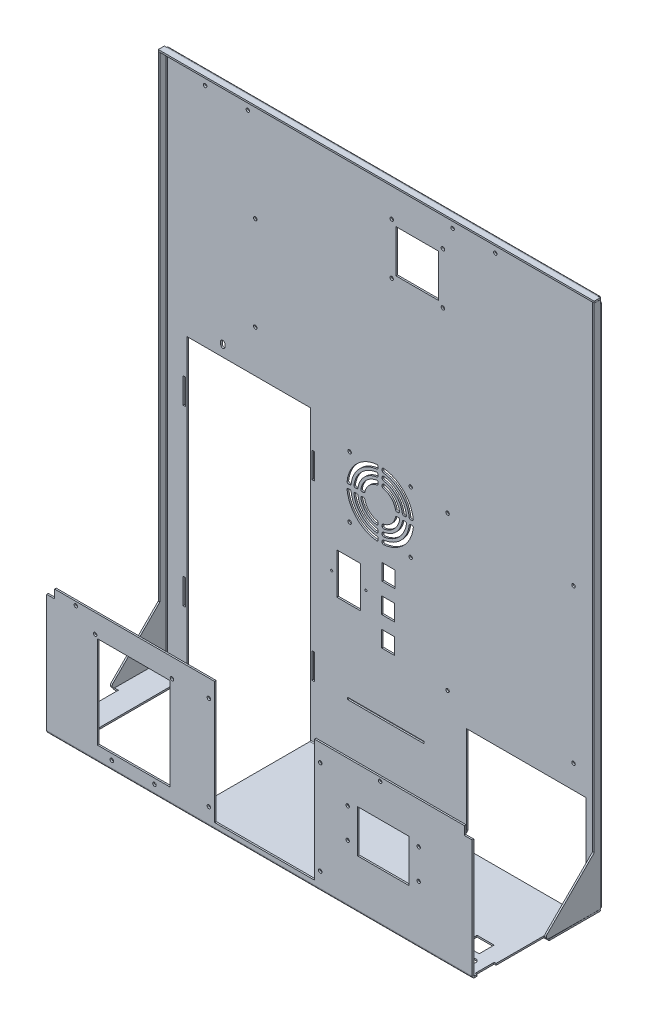
from build123d import *

# Parameters (mm, degrees)
SKETCH1_W                    = 500
SKETCH1_H                    = 616
BASE_FLANGE1_DEPTH           = 1.9
EDGE_FLANGE1_STRIP_W         = 9.6
EDGE_FLANGE1_STRIP_H         = 1.9
EDGE_FLANGE1_STRIP_CUT_DEPTH = 500
EDGE_FLANGE1_DEPTH           = 500
EDGE_FLANGE3_STRIP_W         = 9.6
EDGE_FLANGE3_STRIP_H         = 1.9
EDGE_FLANGE3_STRIP_CUT_DEPTH = 500
EDGE_FLANGE3_DEPTH           = 500
SKETCH18_W                   = 60
SKETCH18_H                   = 50
SKETCH18_W_2                 = 117
SKETCH18_H_2                 = 153.16
SKETCH18_W_3                 = 85
SKETCH18_H_3                 = 108
SKETCH18_R                   = 2.04
CUT_EXTRUDE1_DEPTH           = 2
CUT_EXTRUDE6_DEPTH           = 10
SKETCH54_W                   = 145
SKETCH54_H                   = 174.941221568
CUT_EXTRUDE8_DEPTH           = 340
SKETCH55_R                   = 3.999999998
CUT_EXTRUDE10_DEPTH          = 10
SKETCH56_W                   = 20
SKETCH56_H                   = 17.5
CUT_EXTRUDE11_DEPTH          = 10
SKETCH66_R                   = 2.04
CUT_EXTRUDE15_DEPTH          = 3.21412
SKETCH67_R                   = 2.04
CUT_EXTRUDE16_DEPTH          = 3.21412
EDGE_FLANGE5_DEPTH           = 613.1
EDGE_FLANGE5_BEND_DEPTH      = 613.1
SKETCH76_R                   = 2.04
CUT_EXTRUDE19_DEPTH          = 10
SKETCH78_R                   = 2.04
SKETCH78_W                   = 50
SKETCH78_H                   = 50
CUT_EXTRUDE21_DEPTH          = 10
EDGE_FLANGE6_DEPTH           = 505
CLOSED_START                 = 145.877724614
CLOSED_CORNER1_OUTLINE_W     = 4.55
CLOSED_CORNER1_OUTLINE_H     = 67.1
CLOSED_CORNER1_OUTLINE_W_2   = 1.9
CLOSED_CORNER1_OUTLINE_H_2   = 7.1
CLOSED_CORNER1_DEPTH         = 1.9
CLOSED_START_2               = 144.877724614
CLOSED_CORNER1_2_OUTLINE_W   = 1.9
CLOSED_CORNER1_2_OUTLINE_H   = 7.1
CLOSED_CORNER1_2_DEPTH       = 1
CLOSED_START_3               = -363.022275386
CLOSED_CORNER2_OUTLINE_W     = 4.55
CLOSED_CORNER2_OUTLINE_H     = 67.1
CLOSED_CORNER2_OUTLINE_W_2   = 1.9
CLOSED_CORNER2_OUTLINE_H_2   = 7.1
CLOSED_CORNER2_DEPTH         = 1.9
CLOSED_START_4               = -361.122275386
CLOSED_CORNER2_2_OUTLINE_W   = 1.9
CLOSED_CORNER2_2_OUTLINE_H   = 7.1
CLOSED_CORNER2_2_DEPTH       = 1
SKETCH83_R                   = 2.04
CUT_EXTRUDE23_DEPTH          = 10
SKETCH84_W                   = 3
SKETCH84_H                   = 22.219323402
CUT_EXTRUDE24_DEPTH          = 2
SKETCH86_W                   = 89.593151393
SKETCH86_H                   = 2.431814109
CUT_EXTRUDE25_DEPTH          = 10
SKETCH87_R                   = 2.5
CUT_EXTRUDE26_DEPTH          = 10
SKETCH88_R                   = 2.5
CUT_EXTRUDE29_DEPTH          = 10
SKETCH89_W                   = 10
SKETCH89_H                   = 10
CUT_EXTRUDE28_DEPTH          = 5
SKETCH91_W                   = 0.75
SKETCH91_H                   = 155.908548617
SKETCH91_H_2                 = 115.430886914
CUT_EXTRUDE30_DEPTH          = 150
SKETCH99_R                   = 2.04
CUT_EXTRUDE32_DEPTH          = 10
SKETCH100_W                  = 137.515853673
SKETCH100_H                  = 131.918778432
CUT_EXTRUDE33_DEPTH          = 10
CUT_EXTRUDE34_DEPTH          = 740.00822209
SKETCH102_W                  = 140
SKETCH102_H                  = 110.554078745
CUT_EXTRUDE35_DEPTH          = 20
SKETCH103_W                  = 28
SKETCH103_H                  = 48
CUT_EXTRUDE36_DEPTH          = 62
SKETCH104_W                  = 15
SKETCH104_H                  = 19
CUT_EXTRUDE37_DEPTH          = 62
CLOSED_CORNER3_OUTLINE_W     = 1.9
CLOSED_CORNER3_OUTLINE_H     = 60
CLOSED_CORNER3_DEPTH         = 5.4
CLOSED_CORNER3_2_DEPTH       = 1.9
CLOSED_START_5               = 142.377724614
CLOSED_CORNER4_OUTLINE_W     = 1.9
CLOSED_CORNER4_OUTLINE_H     = 60
CLOSED_CORNER4_DEPTH         = 5.4
CLOSED_CORNER4_2_DEPTH       = 1.9
CUT_EXTRUDE41_DEPTH          = 740.00822209
SKETCH161_W                  = 2.9
SKETCH161_H                  = 30
CUT_EXTRUDE42_DEPTH          = 10
SKETCH162_R                  = 2.5
CUT_EXTRUDE43_DEPTH          = 10
CUT_EXTRUDE44_DEPTH          = 10
SKETCH164_R                  = 1.25
CUT_EXTRUDE45_DEPTH          = 10


# Read off the part's stored shape, not the designer's step: Closed Corner1, Closed Corner2, Closed Corner3, Closed Corner4
# Sheet-metal steps are written as plain solids
with BuildPart() as part:
    # Sketch1 → Base-Flange1 (new body)
    with BuildSketch(Plane.XY):
        with Locations((-107.622275386, 199.456916993)):
            Rectangle(SKETCH1_W, SKETCH1_H)
    extrude(amount=-BASE_FLANGE1_DEPTH)

    # Edge-Flange1 strip (across the edge) → Edge-Flange1 strip cut (cut)
    with BuildSketch(Plane(origin=(-357.622275386, -108.543083007, 0), x_dir=(0, 1, 0), z_dir=(1, 0, 0))):
        with Locations((-1.9, -0.95)):
            Rectangle(EDGE_FLANGE1_STRIP_W, EDGE_FLANGE1_STRIP_H)
    extrude(amount=EDGE_FLANGE1_STRIP_CUT_DEPTH, mode=Mode.SUBTRACT)

    # Edge-Flange1 section (across the edge) → Edge-Flange1 (add)
    with BuildSketch(Plane(origin=(-357.622275386, -108.543083007, 0), x_dir=(0, 1, 0), z_dir=(1, 0, 0))):
        with BuildLine():
            Line((0, 1), (0, 144.96))
            Line((0, 144.96), (1.9, 144.96))
            Line((1.9, 144.96), (1.9, 1))
            ThreePointArc((1.9, 1), (2.192893219, 0.292893219), (2.9, 0))
            Line((2.9, 0), (2.9, -1.9))
            ThreePointArc((2.9, -1.9), (0.849390335, -1.050609665), (0, 1))
        make_face()
    extrude(amount=EDGE_FLANGE1_DEPTH)

    # Edge-Flange3 strip (across the edge) → Edge-Flange3 strip cut (cut)
    with BuildSketch(Plane(origin=(-357.622275386, -106.643083007, 144.96), x_dir=(0, 0, -1), z_dir=(1, 0, 0))):
        with Locations((-1.9, -0.95)):
            Rectangle(EDGE_FLANGE3_STRIP_W, EDGE_FLANGE3_STRIP_H)
    extrude(amount=EDGE_FLANGE3_STRIP_CUT_DEPTH, mode=Mode.SUBTRACT)

    # Edge-Flange3 section (across the edge) → Edge-Flange3 (add)
    with BuildSketch(Plane(origin=(-357.622275386, -106.643083007, 144.96), x_dir=(0, 0, -1), z_dir=(1, 0, 0))):
        with BuildLine():
            Line((0, 1), (0, 149.26))
            Line((0, 149.26), (1.9, 149.26))
            Line((1.9, 149.26), (1.9, 1))
            ThreePointArc((1.9, 1), (2.192893219, 0.292893219), (2.9, 0))
            Line((2.9, 0), (2.9, -1.9))
            ThreePointArc((2.9, -1.9), (0.849390335, -1.050609665), (0, 1))
        make_face()
    extrude(amount=EDGE_FLANGE3_DEPTH)

    # Sketch18 → Cut-Extrude1 (cut)
    with BuildSketch(Plane.XY.offset(144.96)):
        with Locations((37.377724614, -25.643083007)):
            Rectangle(SKETCH18_W, SKETCH18_H)
        with Locations((-101.67397197, -23.963083007)):
            Rectangle(SKETCH18_W_2, SKETCH18_H_2)
        with Locations((-255.122275386, -36.643083007)):
            Rectangle(SKETCH18_W_3, SKETCH18_H_3)
        with Locations((-300.122275386, 20.356916993)):
            Circle(SKETCH18_R)
        with Locations((-210.122275386, 20.356916993)):
            Circle(SKETCH18_R)
        with Locations((-280.622275386, -97.643083007)):
            Circle(SKETCH18_R)
        with Locations((-230.625639047, -97.063122025)):
            Circle(SKETCH18_R)
        with Locations((-166.93397197, 22.056916993)):
            Circle(SKETCH18_R)
        with Locations((-166.93397197, -87.943083007)):
            Circle(SKETCH18_R)
        with Locations((-36.41397197, 22.056916993)):
            Circle(SKETCH18_R)
        with Locations((-36.41397197, -87.943083007)):
            Circle(SKETCH18_R)
        with Locations((-4.224895386, -5.643083007)):
            Circle(SKETCH18_R)
        with Locations((-4.224895386, -40.643083007)):
            Circle(SKETCH18_R)
        with Locations((78.980344614, -5.643083007)):
            Circle(SKETCH18_R)
        with Locations((78.980344614, -40.643083007)):
            Circle(SKETCH18_R)
    extrude(amount=-CUT_EXTRUDE1_DEPTH, mode=Mode.SUBTRACT)

    # Sketch51 → Cut-Extrude6 (cut)
    with BuildSketch(Plane(origin=(0, 0, -1.9), x_dir=(-1, 0, 0), z_dir=(0, 0, -1))):
        with BuildLine():
            Line((77.622275386, 455.956916993), (64.103016085, 455.956916993))
            ThreePointArc((64.103016085, 455.956916993), (49.122275386, 450.456916993), (64.103016085, 444.956916993))
            Line((64.103016085, 444.956916993), (77.622275386, 444.956916993))
            ThreePointArc((77.622275386, 444.956916993), (83.122275386, 450.456916993), (77.622275386, 455.956916993))
        make_face()
    extrude(amount=-CUT_EXTRUDE6_DEPTH, mode=Mode.SUBTRACT)

    # Sketch54 → Cut-Extrude8 (cut)
    with BuildSketch(Plane(origin=(0, -108.543083007, 0), x_dir=(-1, 0, 0), z_dir=(0, -1, 0))):
        with Locations((265.122275386, 84.429389216)):
            Rectangle(SKETCH54_W, SKETCH54_H)
    extrude(amount=-CUT_EXTRUDE8_DEPTH, mode=Mode.SUBTRACT)

    # Sketch55 → Cut-Extrude10 (cut)
    with BuildSketch(Plane.XZ.offset(108.543083007)):
        with Locations(Location((125.035496452, 128.18, 0), (0, 0, 270))):
            Circle(SKETCH55_R)
        with Locations(Location((-340.280047224, 128.18, 0), (0, 0, 270))):
            Circle(SKETCH55_R)
    extrude(amount=-CUT_EXTRUDE10_DEPTH, mode=Mode.SUBTRACT)

    # Sketch56 → Cut-Extrude11 (cut)
    with BuildSketch(Plane(origin=(0, -108.543083007, 0), x_dir=(-1, 0, 0), z_dir=(0, -1, 0))):
        with Locations((-111.917595603, -108.273341907)):
            Rectangle(SKETCH56_W, SKETCH56_H)
    extrude(amount=-CUT_EXTRUDE11_DEPTH, mode=Mode.SUBTRACT)

    # Sketch66 → Cut-Extrude15 (cut)
    with BuildSketch(Plane.XY):
        with Locations((-32.193957988, 204.920176993)):
            Circle(SKETCH66_R)
        with Locations((115.411282012, 204.920176993)):
            Circle(SKETCH66_R)
        with Locations((-32.193957988, 24.920176993)):
            Circle(SKETCH66_R)
        with Locations((115.411282012, 24.920176993)):
            Circle(SKETCH66_R)
    extrude(amount=-CUT_EXTRUDE15_DEPTH, mode=Mode.SUBTRACT)

    # Sketch67 → Cut-Extrude16 (cut)
    with BuildSketch(Plane.XY.offset(144.96)):
        with Locations((-322.795569154, 38.116916993)):
            Circle(SKETCH67_R)
        with Locations((33.746280713, 38.116916993)):
            Circle(SKETCH67_R)
    extrude(amount=-CUT_EXTRUDE16_DEPTH, mode=Mode.SUBTRACT)

    # Edge-Flange5 section (across the edge) → Edge-Flange5 (add)
    with BuildSketch(Plane(origin=(145.877724614, -105.643083007, 0), x_dir=(-1, 0, 0), z_dir=(0, 1, 0))):
        with BuildLine():
            Line((-1.9, 1), (-1.9, 68.1))
            Line((-1.9, 68.1), (0, 68.1))
            Line((0, 68.1), (0, 1))
            ThreePointArc((0, 1), (0.292893219, 0.292893219), (1, 0))
            Line((1, 0), (3.5, 0))
            Line((3.5, 0), (3.5, -1.9))
            Line((3.5, -1.9), (1, -1.9))
            ThreePointArc((1, -1.9), (-1.050609665, -1.050609665), (-1.9, 1))
        make_face()
    extrude(amount=EDGE_FLANGE5_DEPTH)

    # Edge-Flange5 section 2 (across the edge) → Edge-Flange5 bend (add)
    with BuildSketch(Plane(origin=(-361.122275386, 507.456916993, 0), x_dir=(1, 0, 0), z_dir=(0, -1, 0))):
        with BuildLine():
            Line((-1.9, 1), (-1.9, 68.1))
            Line((-1.9, 68.1), (0, 68.1))
            Line((0, 68.1), (0, 1))
            ThreePointArc((0, 1), (0.292893219, 0.292893219), (1, 0))
            Line((1, 0), (3.5, 0))
            Line((3.5, 0), (3.5, -1.9))
            Line((3.5, -1.9), (1, -1.9))
            ThreePointArc((1, -1.9), (-1.050609665, -1.050609665), (-1.9, 1))
        make_face()
    extrude(amount=EDGE_FLANGE5_BEND_DEPTH)

    # Sketch76 → Cut-Extrude19 (cut)
    with BuildSketch(Plane.XY):
        with Locations((-257.493957988, 391.022796993)):
            Circle(SKETCH76_R)
        with Locations((-257.493957988, 281.022796993)):
            Circle(SKETCH76_R)
    extrude(amount=-CUT_EXTRUDE19_DEPTH, mode=Mode.SUBTRACT)

    # Sketch78 → Cut-Extrude21 (cut)
    with BuildSketch(Plane.XY):
        with Locations((-97.622275386, 470.456916993)):
            Circle(SKETCH78_R)
        with Locations((-37.622275386, 470.456916993)):
            Circle(SKETCH78_R)
        with Locations((-37.622275386, 410.456916993)):
            Circle(SKETCH78_R)
        with Locations((-97.622275386, 410.456916993)):
            Circle(SKETCH78_R)
        with Locations((-67.622275386, 440.456916993)):
            Rectangle(SKETCH78_W, SKETCH78_H)
    extrude(amount=-CUT_EXTRUDE21_DEPTH, mode=Mode.SUBTRACT)

    # Edge-Flange6 section (across the edge) → Edge-Flange6 (add)
    with BuildSketch(Plane(origin=(144.877724614, 512.106916993, 0), x_dir=(0, -1, 0), z_dir=(-1, 0, 0))):
        with BuildLine():
            Line((-1.9, 1), (-1.9, 8.1))
            Line((-1.9, 8.1), (0, 8.1))
            Line((0, 8.1), (0, 1))
            ThreePointArc((0, 1), (0.292893219, 0.292893219), (1, 0))
            Line((1, 0), (4.65, 0))
            Line((4.65, 0), (4.65, -1.9))
            Line((4.65, -1.9), (1, -1.9))
            ThreePointArc((1, -1.9), (-1.050609665, -1.050609665), (-1.9, 1))
        make_face()
    extrude(amount=EDGE_FLANGE6_DEPTH)

    # Closed Corner1 outline → Closed Corner1 (add)
    with BuildSketch(Plane.YZ.offset(CLOSED_START)):
        with Locations((509.731916993, 34.55)):
            Rectangle(CLOSED_CORNER1_OUTLINE_W, CLOSED_CORNER1_OUTLINE_H)
        with Locations((513.056916993, 4.55)):
            Rectangle(CLOSED_CORNER1_OUTLINE_W_2, CLOSED_CORNER1_OUTLINE_H_2)
    extrude(amount=CLOSED_CORNER1_DEPTH)

    # Closed Corner1 2 outline → Closed Corner1 2 (add)
    with BuildSketch(Plane.YZ.offset(CLOSED_START_2)):
        with Locations((513.056916993, 4.55)):
            Rectangle(CLOSED_CORNER1_2_OUTLINE_W, CLOSED_CORNER1_2_OUTLINE_H)
    extrude(amount=CLOSED_CORNER1_2_DEPTH)

    # Closed Corner2 outline → Closed Corner2 (add)
    with BuildSketch(Plane.YZ.offset(CLOSED_START_3)):
        with Locations((509.731916993, 34.55)):
            Rectangle(CLOSED_CORNER2_OUTLINE_W, CLOSED_CORNER2_OUTLINE_H)
        with Locations((513.056916993, 4.55)):
            Rectangle(CLOSED_CORNER2_OUTLINE_W_2, CLOSED_CORNER2_OUTLINE_H_2)
    extrude(amount=CLOSED_CORNER2_DEPTH)

    # Closed Corner2 2 outline → Closed Corner2 2 (add)
    with BuildSketch(Plane.YZ.offset(CLOSED_START_4)):
        with Locations((513.056916993, 4.55)):
            Rectangle(CLOSED_CORNER2_2_OUTLINE_W, CLOSED_CORNER2_2_OUTLINE_H)
    extrude(amount=CLOSED_CORNER2_2_DEPTH)

    # Sketch83 → Cut-Extrude23 (cut)
    with BuildSketch(Plane(origin=(0, 0, -1.9), x_dir=(-1, 0, 0), z_dir=(0, 0, -1))):
        with Locations((-23.767050846, 496.764856993)):
            Circle(SKETCH83_R)
        with Locations((26.232949154, 496.764856993)):
            Circle(SKETCH83_R)
        with Locations((266.232949154, 496.764856993)):
            Circle(SKETCH83_R)
        with Locations((316.232949154, 496.764856993)):
            Circle(SKETCH83_R)
    extrude(amount=-CUT_EXTRUDE23_DEPTH, mode=Mode.SUBTRACT)

    # Sketch84 → Cut-Extrude24 (cut)
    with BuildSketch(Plane.XZ.offset(108.543083007)):
        with Locations((-356.122275386, 128.02122392)):
            Rectangle(SKETCH84_W, SKETCH84_H)
        with Locations((140.877724614, 128.02122392)):
            Rectangle(SKETCH84_W, SKETCH84_H)
    extrude(amount=-CUT_EXTRUDE24_DEPTH, mode=Mode.SUBTRACT)

    # Sketch86 → Cut-Extrude25 (cut)
    with BuildSketch(Plane(origin=(0, 0, -1.9), x_dir=(-1, 0, 0), z_dir=(0, 0, -1))):
        with Locations((104.43682481, -41.63719723)):
            Rectangle(SKETCH86_W, SKETCH86_H)
    extrude(amount=-CUT_EXTRUDE25_DEPTH, mode=Mode.SUBTRACT)

    # Sketch87 → Cut-Extrude26 (cut)
    with BuildSketch(Plane(origin=(0, 0, -1.9), x_dir=(-1, 0, 0), z_dir=(0, 0, -1))):
        with Locations((295.475852873, 242.856916993)):
            Circle(SKETCH87_R)
    extrude(amount=-CUT_EXTRUDE26_DEPTH, mode=Mode.SUBTRACT)

    # Sketch88 → Cut-Extrude29 (cut)
    with BuildSketch(Plane(origin=(0, -106.643083007, 0), x_dir=(1, 0, 0), z_dir=(0, 1, 0))):
        with Locations(Location((-334.692275386, -109.881948443, 0), (0, 0, 270))):
            Circle(SKETCH88_R)
        with Locations(Location((-188.122275386, -129.881948443, 0), (0, 0, 270))):
            Circle(SKETCH88_R)
    extrude(amount=-CUT_EXTRUDE29_DEPTH, mode=Mode.SUBTRACT)

    # Sketch89 → Cut-Extrude28 (cut)
    with BuildSketch(Plane.XY.offset(144.96)):
        with Locations((-352.622275386, 37.616916993)):
            Rectangle(SKETCH89_W, SKETCH89_H)
        with Locations((137.377724614, 37.616916993)):
            Rectangle(SKETCH89_W, SKETCH89_H)
    extrude(amount=-CUT_EXTRUDE28_DEPTH, mode=Mode.SUBTRACT)

    # Sketch91 → Cut-Extrude30 (cut)
    with BuildSketch(Plane.XZ.offset(108.543083007)):
        with Locations((-357.304122799, 138.954274309)):
            Rectangle(SKETCH91_W, SKETCH91_H)
        with Locations((142.002724614, 118.715443457)):
            Rectangle(SKETCH91_W, SKETCH91_H_2)
    extrude(amount=-CUT_EXTRUDE30_DEPTH, mode=Mode.SUBTRACT)

    # Sketch99 → Cut-Extrude32 (cut)
    with BuildSketch(Plane(origin=(0, 0, -1.9), x_dir=(-1, 0, 0), z_dir=(0, 0, -1))):
        with Locations((146.885395546, 209.882570308)):
            Circle(SKETCH99_R)
        with Locations((75.385395546, 209.882570308)):
            Circle(SKETCH99_R)
        with Locations((75.385395546, 138.382570308)):
            Circle(SKETCH99_R)
        with Locations((146.885395546, 138.382570308)):
            Circle(SKETCH99_R)
        with BuildLine():
            Line((113.516645546, 154.581316552), (113.516645546, 152.963892274))
            ThreePointArc((113.516645546, 152.963892274), (114.090300643, 151.742305289), (115.396676742, 151.403577643))
            ThreePointArc((115.396676742, 151.403577643), (127.487239861, 157.780725993), (133.864388211, 169.871289112))
            ThreePointArc((133.864388211, 169.871289112), (133.525660565, 171.177665211), (132.30407358, 171.751320308))
            Line((132.30407358, 171.751320308), (130.686649302, 171.751320308))
            ThreePointArc((130.686649302, 171.751320308), (129.681957963, 171.392946649), (129.13087911, 170.479629362))
            ThreePointArc((129.13087911, 170.479629362), (124.119643816, 161.148322038), (114.788336492, 156.137086744))
            ThreePointArc((114.788336492, 156.137086744), (113.875019206, 155.586007892), (113.516645546, 154.581316552))
        make_face()
        with BuildLine():
            Line((113.516645546, 146.528916932), (113.516645546, 144.925984605))
            ThreePointArc((113.516645546, 144.925984605), (114.059918025, 143.7302651), (115.317899257, 143.352941185))
            ThreePointArc((115.317899257, 143.352941185), (133.099899937, 152.168065917), (141.915024669, 169.950066597))
            ThreePointArc((141.915024669, 169.950066597), (141.537700754, 171.20804783), (140.341981249, 171.751320308))
            Line((140.341981249, 171.751320308), (138.739048922, 171.751320308))
            ThreePointArc((138.739048922, 171.751320308), (137.699456311, 171.36357172), (137.167706932, 170.38974198))
            ThreePointArc((137.167706932, 170.38974198), (129.732303892, 155.535661963), (114.878223874, 148.100258922))
            ThreePointArc((114.878223874, 148.100258922), (113.904394134, 147.568509544), (113.516645546, 146.528916932))
        make_face()
        with BuildLine():
            Line((113.516645546, 138.528081147), (113.516645546, 136.93117007))
            ThreePointArc((113.516645546, 136.93117007), (114.042821863, 135.750598898), (115.272548904, 135.352627527))
            ThreePointArc((115.272548904, 135.352627527), (138.712560013, 146.555405842), (149.915338327, 169.99541695))
            ThreePointArc((149.915338327, 169.99541695), (149.517366956, 171.225143991), (148.336795785, 171.751320308))
            Line((148.336795785, 171.751320308), (146.739884708, 171.751320308))
            ThreePointArc((146.739884708, 171.751320308), (145.681355217, 171.346897468), (145.162156123, 170.339686061))
            ThreePointArc((145.162156123, 170.339686061), (135.344963967, 149.923001887), (114.928279793, 140.105809731))
            ThreePointArc((114.928279793, 140.105809731), (113.921068386, 139.586610637), (113.516645546, 138.528081147))
        make_face()
        with BuildLine():
            Line((91.58414179, 171.751320308), (89.966717513, 171.751320308))
            ThreePointArc((89.966717513, 171.751320308), (88.745130528, 171.177665211), (88.406402881, 169.871289112))
            ThreePointArc((88.406402881, 169.871289112), (94.783551231, 157.780725993), (106.874114351, 151.403577643))
            ThreePointArc((106.874114351, 151.403577643), (108.18049045, 151.742305289), (108.754145546, 152.963892274))
            Line((108.754145546, 152.963892274), (108.754145546, 154.581316552))
            ThreePointArc((108.754145546, 154.581316552), (108.395771887, 155.586007892), (107.4824546, 156.137086744))
            ThreePointArc((107.4824546, 156.137086744), (98.151147277, 161.148322038), (93.139911983, 170.479629362))
            ThreePointArc((93.139911983, 170.479629362), (92.58883313, 171.392946649), (91.58414179, 171.751320308))
        make_face()
        with BuildLine():
            Line((83.531742171, 171.751320308), (81.928809843, 171.751320308))
            ThreePointArc((81.928809843, 171.751320308), (80.733090339, 171.20804783), (80.355766423, 169.950066597))
            ThreePointArc((80.355766423, 169.950066597), (89.170891156, 152.168065917), (106.952891836, 143.352941185))
            ThreePointArc((106.952891836, 143.352941185), (108.210873068, 143.7302651), (108.754145546, 144.925984605))
            Line((108.754145546, 144.925984605), (108.754145546, 146.528916932))
            ThreePointArc((108.754145546, 146.528916932), (108.366396959, 147.568509544), (107.392567218, 148.100258922))
            ThreePointArc((107.392567218, 148.100258922), (92.538487201, 155.535661963), (85.10308416, 170.38974198))
            ThreePointArc((85.10308416, 170.38974198), (84.571334782, 171.36357172), (83.531742171, 171.751320308))
        make_face()
        with BuildLine():
            Line((75.530906385, 171.751320308), (73.933995308, 171.751320308))
            ThreePointArc((73.933995308, 171.751320308), (72.753424137, 171.225143991), (72.355452765, 169.99541695))
            ThreePointArc((72.355452765, 169.99541695), (83.55823108, 146.555405842), (106.998242188, 135.352627527))
            ThreePointArc((106.998242188, 135.352627527), (108.227969229, 135.750598898), (108.754145546, 136.93117007))
            Line((108.754145546, 136.93117007), (108.754145546, 138.528081147))
            ThreePointArc((108.754145546, 138.528081147), (108.349722706, 139.586610637), (107.3425113, 140.105809731))
            ThreePointArc((107.3425113, 140.105809731), (86.925827125, 149.923001887), (77.10863497, 170.339686061))
            ThreePointArc((77.10863497, 170.339686061), (76.589435876, 171.346897468), (75.530906385, 171.751320308))
        make_face()
        with BuildLine():
            Line((108.754145546, 193.683824064), (108.754145546, 195.301248341))
            ThreePointArc((108.754145546, 195.301248341), (108.18049045, 196.522835326), (106.874114351, 196.861562973))
            ThreePointArc((106.874114351, 196.861562973), (94.783551231, 190.484414623), (88.406402881, 178.393851503))
            ThreePointArc((88.406402881, 178.393851503), (88.745130528, 177.087475404), (89.966717513, 176.513820308))
            Line((89.966717513, 176.513820308), (91.58414179, 176.513820308))
            ThreePointArc((91.58414179, 176.513820308), (92.58883313, 176.872193967), (93.139911983, 177.785511254))
            ThreePointArc((93.139911983, 177.785511254), (98.151147277, 187.116818577), (107.4824546, 192.128053872))
            ThreePointArc((107.4824546, 192.128053872), (108.395771887, 192.679132724), (108.754145546, 193.683824064))
        make_face()
        with BuildLine():
            Line((108.754145546, 201.736223684), (108.754145546, 203.339156011))
            ThreePointArc((108.754145546, 203.339156011), (108.210873068, 204.534875515), (106.952891836, 204.912199431))
            ThreePointArc((106.952891836, 204.912199431), (89.170891156, 196.097074698), (80.355766423, 178.315074019))
            ThreePointArc((80.355766423, 178.315074019), (80.733090339, 177.057092786), (81.928809843, 176.513820308))
            Line((81.928809843, 176.513820308), (83.531742171, 176.513820308))
            ThreePointArc((83.531742171, 176.513820308), (84.571334782, 176.901568895), (85.10308416, 177.875398636))
            ThreePointArc((85.10308416, 177.875398636), (92.538487201, 192.729478653), (107.392567218, 200.164881694))
            ThreePointArc((107.392567218, 200.164881694), (108.366396959, 200.696631072), (108.754145546, 201.736223684))
        make_face()
        with BuildLine():
            Line((108.754145546, 209.737059469), (108.754145546, 211.333970546))
            ThreePointArc((108.754145546, 211.333970546), (108.227969229, 212.514541717), (106.998242188, 212.912513089))
            ThreePointArc((106.998242188, 212.912513089), (83.55823108, 201.709734774), (72.355452765, 178.269723666))
            ThreePointArc((72.355452765, 178.269723666), (72.753424137, 177.039996625), (73.933995308, 176.513820308))
            Line((73.933995308, 176.513820308), (75.530906385, 176.513820308))
            ThreePointArc((75.530906385, 176.513820308), (76.589435876, 176.918243148), (77.10863497, 177.925454554))
            ThreePointArc((77.10863497, 177.925454554), (86.925827125, 198.342138729), (107.3425113, 208.159330885))
            ThreePointArc((107.3425113, 208.159330885), (108.349722706, 208.678529978), (108.754145546, 209.737059469))
        make_face()
        with BuildLine():
            Line((130.686649302, 176.513820308), (132.30407358, 176.513820308))
            ThreePointArc((132.30407358, 176.513820308), (133.525660565, 177.087475404), (133.864388211, 178.393851503))
            ThreePointArc((133.864388211, 178.393851503), (127.487239861, 190.484414623), (115.396676742, 196.861562973))
            ThreePointArc((115.396676742, 196.861562973), (114.090300643, 196.522835326), (113.516645546, 195.301248341))
            Line((113.516645546, 195.301248341), (113.516645546, 193.683824064))
            ThreePointArc((113.516645546, 193.683824064), (113.875019206, 192.679132724), (114.788336492, 192.128053872))
            ThreePointArc((114.788336492, 192.128053872), (124.119643816, 187.116818577), (129.13087911, 177.785511254))
            ThreePointArc((129.13087911, 177.785511254), (129.681957963, 176.872193967), (130.686649302, 176.513820308))
        make_face()
        with BuildLine():
            Line((138.739048922, 176.513820308), (140.341981249, 176.513820308))
            ThreePointArc((140.341981249, 176.513820308), (141.537700754, 177.057092786), (141.915024669, 178.315074019))
            ThreePointArc((141.915024669, 178.315074019), (133.099899937, 196.097074698), (115.317899257, 204.912199431))
            ThreePointArc((115.317899257, 204.912199431), (114.059918025, 204.534875515), (113.516645546, 203.339156011))
            Line((113.516645546, 203.339156011), (113.516645546, 201.736223684))
            ThreePointArc((113.516645546, 201.736223684), (113.904394134, 200.696631072), (114.878223874, 200.164881694))
            ThreePointArc((114.878223874, 200.164881694), (129.732303892, 192.729478653), (137.167706932, 177.875398636))
            ThreePointArc((137.167706932, 177.875398636), (137.699456311, 176.901568895), (138.739048922, 176.513820308))
        make_face()
        with BuildLine():
            Line((146.739884708, 176.513820308), (148.336795785, 176.513820308))
            ThreePointArc((148.336795785, 176.513820308), (149.517366956, 177.039996625), (149.915338327, 178.269723666))
            ThreePointArc((149.915338327, 178.269723666), (138.712560013, 201.709734774), (115.272548904, 212.912513089))
            ThreePointArc((115.272548904, 212.912513089), (114.042821863, 212.514541717), (113.516645546, 211.333970546))
            Line((113.516645546, 211.333970546), (113.516645546, 209.737059469))
            ThreePointArc((113.516645546, 209.737059469), (113.921068386, 208.678529978), (114.928279793, 208.159330885))
            ThreePointArc((114.928279793, 208.159330885), (135.344963967, 198.342138729), (145.162156123, 177.925454554))
            ThreePointArc((145.162156123, 177.925454554), (145.681355217, 176.918243148), (146.739884708, 176.513820308))
        make_face()
    extrude(amount=-CUT_EXTRUDE32_DEPTH, mode=Mode.SUBTRACT)

    # Sketch100 → Cut-Extrude33 (cut)
    with BuildSketch(Plane(origin=(0, -106.643083007, 0), x_dir=(1, 0, 0), z_dir=(0, 1, 0))):
        with Locations((-261.380202222, -69.000610784)):
            Rectangle(SKETCH100_W, SKETCH100_H)
    extrude(amount=-CUT_EXTRUDE33_DEPTH, mode=Mode.SUBTRACT)

    # Sketch101 → Cut-Extrude34 (cut, through all)
    with BuildSketch(Plane(origin=(147.777724614, 0, 0), x_dir=(0, 0, -1), z_dir=(1, 0, 0))):
        Polygon((-8.1, 514.006916993), (-8.1, -45.643083007), (-68.1, -105.643083007), (-68.1, 512.006916993), align=None)
    extrude(amount=-CUT_EXTRUDE34_DEPTH, mode=Mode.SUBTRACT)

    # Sketch102 → Cut-Extrude35 (cut)
    with BuildSketch(Plane(origin=(0, 0, -1.9), x_dir=(-1, 0, 0), z_dir=(0, 0, -1))):
        with Locations((-59.877724614, -57.901105973)):
            Rectangle(SKETCH102_W, SKETCH102_H)
    extrude(amount=-CUT_EXTRUDE35_DEPTH, mode=Mode.SUBTRACT)

    # Sketch103 → Cut-Extrude36 (cut)
    with BuildSketch(Plane(origin=(0, 0, -1.9), x_dir=(-1, 0, 0), z_dir=(0, 0, -1))):
        with Locations((147.935801948, 78.765806702)):
            Rectangle(SKETCH103_W, SKETCH103_H)
    extrude(amount=-CUT_EXTRUDE36_DEPTH, mode=Mode.SUBTRACT)

    # Sketch104 → Cut-Extrude37 (cut)
    with BuildSketch(Plane(origin=(0, 0, -1.9), x_dir=(-1, 0, 0), z_dir=(0, 0, -1))):
        with Locations((101.435801948, 106.896713594)):
            Rectangle(SKETCH104_W, SKETCH104_H)
        with Locations((102.020062066, 38.896713594)):
            Rectangle(SKETCH104_W, SKETCH104_H)
        with Locations((102.020062066, 72.896713594)):
            Rectangle(SKETCH104_W, SKETCH104_H)
    extrude(amount=-CUT_EXTRUDE37_DEPTH, mode=Mode.SUBTRACT)

    # Closed Corner3 outline → Closed Corner3 (add)
    with BuildSketch(Plane.YZ.offset(CLOSED_START_3)):
        with Locations((-107.593083007, 31)):
            Rectangle(CLOSED_CORNER3_OUTLINE_W, CLOSED_CORNER3_OUTLINE_H)
    extrude(amount=CLOSED_CORNER3_DEPTH)

    # Closed Corner3 2 outline → Closed Corner3 2 (add)
    with BuildSketch(Plane.YZ.offset(CLOSED_START_3)):
        Polygon((-106.543083007, 1), (-105.643083007, 1), (-105.643083007, 68.1), (-106.27947911, 68.736396103), align=None)
    extrude(amount=CLOSED_CORNER3_2_DEPTH)

    # Closed Corner4 outline → Closed Corner4 (add)
    with BuildSketch(Plane.YZ.offset(CLOSED_START_5)):
        with Locations((-107.593083007, 31)):
            Rectangle(CLOSED_CORNER4_OUTLINE_W, CLOSED_CORNER4_OUTLINE_H)
    extrude(amount=CLOSED_CORNER4_DEPTH)

    # Closed Corner4 2 outline → Closed Corner4 2 (add)
    with BuildSketch(Plane.YZ.offset(CLOSED_START)):
        Polygon((-106.27947911, 68.736396103), (-106.543083007, 1), (-105.643083007, 1), (-105.643083007, 68.1), align=None)
    extrude(amount=CLOSED_CORNER4_2_DEPTH)

    # Sketch160 → Cut-Extrude41 (cut, through all)
    with BuildSketch(Plane(origin=(147.777724614, 0, 0), x_dir=(0, 0, -1), z_dir=(1, 0, 0))):
        with BuildLine():
            Line((-68.736396103, -106.27947911), (-61.053289688, -106.309378793))
            ThreePointArc((-61.053289688, -106.309378793), (-63.999628322, -104.328235111), (-63.303578318, -100.846661325))
            Line((-63.303578318, -100.846661325), (-68.736396103, -106.27947911))
        make_face()
    extrude(amount=-CUT_EXTRUDE41_DEPTH, mode=Mode.SUBTRACT)

    # Sketch161 → Cut-Extrude42 (cut)
    with BuildSketch(Plane.XY):
        with Locations((-340.572275386, -29.112820774)):
            Rectangle(SKETCH161_W, SKETCH161_H)
        with Locations((-189.672275386, -29.112820774)):
            Rectangle(SKETCH161_W, SKETCH161_H)
        with Locations((-340.572275386, 174.399490868)):
            Rectangle(SKETCH161_W, SKETCH161_H)
        with Locations((-189.672275386, 174.399490868)):
            Rectangle(SKETCH161_W, SKETCH161_H)
    extrude(amount=-CUT_EXTRUDE42_DEPTH, mode=Mode.SUBTRACT)

    # Sketch162 → Cut-Extrude43 (cut)
    with BuildSketch(Plane(origin=(0, -106.643083007, 0), x_dir=(1, 0, 0), z_dir=(0, 1, 0))):
        with Locations(Location((-49.197330888, -35.508981665, 0), (0, 0, 270))):
            Circle(SKETCH162_R)
    extrude(amount=-CUT_EXTRUDE43_DEPTH, mode=Mode.SUBTRACT)

    # Sketch163 → Cut-Extrude44 (cut)
    with BuildSketch(Plane.XY):
        with BuildLine():
            Line((-297.958009166, 242.558755733), (-297.958009166, 247.13277552))
            ThreePointArc((-297.958009166, 247.13277552), (-295.594877163, 248.525027622), (-293.23174516, 247.13277552))
            Line((-293.23174516, 247.13277552), (-292.975852873, 242.856916993))
            Line((-292.975852873, 242.856916993), (-297.958009166, 242.558755733))
        make_face()
    extrude(amount=-CUT_EXTRUDE44_DEPTH, mode=Mode.SUBTRACT)

    # Sketch164 → Cut-Extrude45 (cut)
    with BuildSketch(Plane(origin=(0, 0, -1.9), x_dir=(-1, 0, 0), z_dir=(0, 0, -1))):
        with Locations((127.935801948, 78.765806702)):
            Circle(SKETCH164_R)
        with Locations((167.935801948, 78.765806702)):
            Circle(SKETCH164_R)
    extrude(amount=-CUT_EXTRUDE45_DEPTH, mode=Mode.SUBTRACT)


solid = part.part
